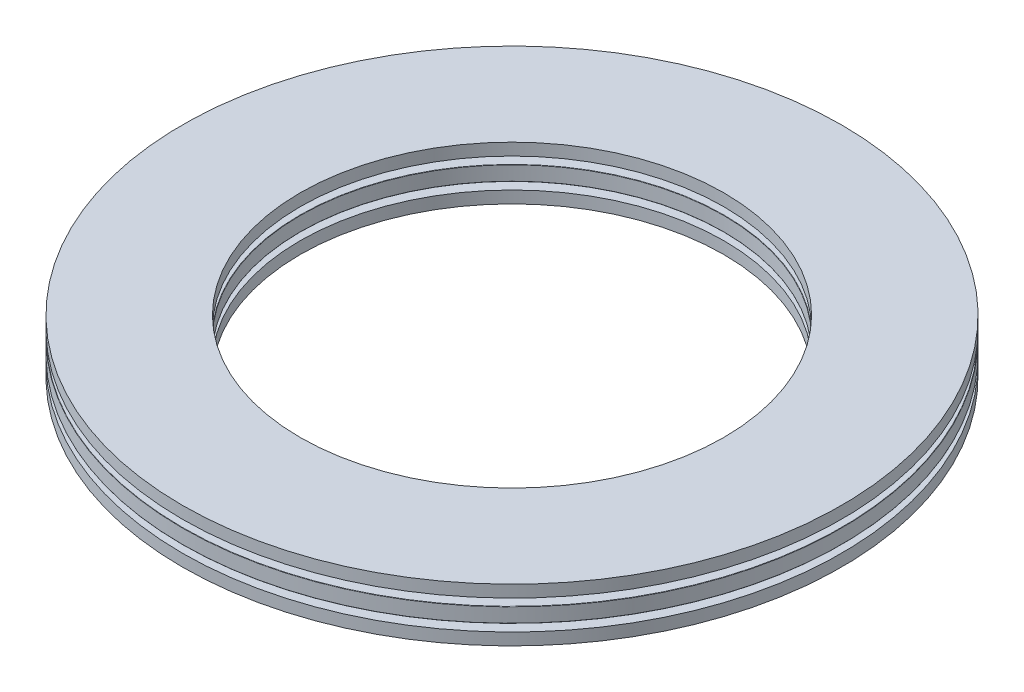
from build123d import *

# Parameters (mm, degrees)
SKETCH1_W                = 7.9375
SKETCH1_H                = 0.9921875
SKETCH3_W                = 5.953125
SKETCH3_H                = 0.9921875
SKETCH2_W                = 5.953125
SKETCH2_H                = 0.9921875
CIRPATTERN1_START        = -21.2328125
CIRPATTERN1_OUTLINE_R    = 0.9921875
CIRPATTERN1_DEPTH        = 5.953125
CIRPATTERN1_2_OUTLINE_R  = 0.9921875
CIRPATTERN1_2_DEPTH      = 5.953125
CIRPATTERN1_3_OUTLINE_R  = 0.9921875
CIRPATTERN1_3_DEPTH      = 5.953125
CIRPATTERN1_4_OUTLINE_R  = 0.9921875
CIRPATTERN1_4_DEPTH      = 5.953125
CIRPATTERN1_5_OUTLINE_R  = 0.9921875
CIRPATTERN1_5_DEPTH      = 5.953125
CIRPATTERN1_6_OUTLINE_R  = 0.9921875
CIRPATTERN1_6_DEPTH      = 5.953125
CIRPATTERN1_7_OUTLINE_R  = 0.9921875
CIRPATTERN1_7_DEPTH      = 5.953125
CIRPATTERN1_8_OUTLINE_R  = 0.9921875
CIRPATTERN1_8_DEPTH      = 5.953125
CIRPATTERN1_9_OUTLINE_R  = 0.9921875
CIRPATTERN1_9_DEPTH      = 5.953125
CIRPATTERN1_10_OUTLINE_R = 0.9921875
CIRPATTERN1_10_DEPTH     = 5.953125
CIRPATTERN1_11_OUTLINE_R = 0.9921875
CIRPATTERN1_11_DEPTH     = 5.953125
CIRPATTERN1_12_OUTLINE_R = 0.9921875
CIRPATTERN1_12_DEPTH     = 5.953125
CIRPATTERN1_13_OUTLINE_R = 0.9921875
CIRPATTERN1_13_DEPTH     = 5.953125
CIRPATTERN1_14_OUTLINE_R = 0.9921875
CIRPATTERN1_14_DEPTH     = 5.953125
CIRPATTERN1_15_OUTLINE_R = 0.9921875
CIRPATTERN1_15_DEPTH     = 5.953125
CIRPATTERN1_16_OUTLINE_R = 0.9921875
CIRPATTERN1_16_DEPTH     = 5.953125
CIRPATTERN1_17_OUTLINE_R = 0.9921875
CIRPATTERN1_17_DEPTH     = 5.953125
CIRPATTERN1_START_2      = 15.2796875
CIRPATTERN1_18_OUTLINE_R = 0.9921875
CIRPATTERN1_18_DEPTH     = 5.953125
CIRPATTERN1_19_OUTLINE_R = 0.9921875
CIRPATTERN1_19_DEPTH     = 5.953125
CIRPATTERN1_20_OUTLINE_R = 0.9921875
CIRPATTERN1_20_DEPTH     = 5.953125
CIRPATTERN1_21_OUTLINE_R = 0.9921875
CIRPATTERN1_21_DEPTH     = 5.953125
CIRPATTERN1_22_OUTLINE_R = 0.9921875
CIRPATTERN1_22_DEPTH     = 5.953125
CIRPATTERN1_23_OUTLINE_R = 0.9921875
CIRPATTERN1_23_DEPTH     = 5.953125
CIRPATTERN1_24_OUTLINE_R = 0.9921875
CIRPATTERN1_24_DEPTH     = 5.953125
CIRPATTERN1_25_OUTLINE_R = 0.9921875
CIRPATTERN1_25_DEPTH     = 5.953125
CIRPATTERN1_26_OUTLINE_R = 0.9921875
CIRPATTERN1_26_DEPTH     = 5.953125
CIRPATTERN1_27_OUTLINE_R = 0.9921875
CIRPATTERN1_27_DEPTH     = 5.953125
CIRPATTERN1_28_OUTLINE_R = 0.9921875
CIRPATTERN1_28_DEPTH     = 5.953125
CIRPATTERN1_29_OUTLINE_R = 0.9921875
CIRPATTERN1_29_DEPTH     = 5.953125
CIRPATTERN1_30_OUTLINE_R = 0.9921875
CIRPATTERN1_30_DEPTH     = 5.953125
CIRPATTERN1_31_OUTLINE_R = 0.9921875
CIRPATTERN1_31_DEPTH     = 5.953125
CIRPATTERN1_32_OUTLINE_R = 0.9921875
CIRPATTERN1_32_DEPTH     = 5.953125
CIRPATTERN1_33_OUTLINE_R = 0.9921875
CIRPATTERN1_33_DEPTH     = 5.953125
CIRPATTERN1_34_OUTLINE_R = 0.9921875
CIRPATTERN1_34_DEPTH     = 5.953125
CIRPATTERN2_COUNT        = 35
SKETCH4_W                = 7.9375
SKETCH4_H                = 0.8128
FILLET2_R                = 0.01984375


# Read off the part's stored shape, not the designer's step: CirPattern1
with BuildPart() as part:
    # Sketch1 → Revolve1 (revolve)
    with BuildSketch(Plane(origin=(0, 0, 0), x_dir=(0, 0, -1), z_dir=(1, 0, 0)), mode=Mode.PRIVATE) as revolve1_sk:
        with Locations((-18.25625, 0)):
            Rectangle(SKETCH1_W, SKETCH1_H)
    revolve(revolve1_sk.sketch.rotate(Axis((0, -0.9921875, 0), (0, 1, 0)), 180), axis=Axis((0, -0.9921875, 0), (0, 1, 0)))

    # Sketch3 → Cut-Revolve1 (revolve, cut)
    with BuildSketch(Plane(origin=(0, 0, 0), x_dir=(0, 0, -1), z_dir=(1, 0, 0))):
        with Locations((-18.25625, 0.49609375)):
            Rectangle(SKETCH3_W, SKETCH3_H)
    cut_revolve1 = revolve(axis=Axis((0, 0, 21.2328125), (0, 0, -1)), mode=Mode.SUBTRACT)

    # CirPattern2: Cut-Revolve1 ×35 about axis
    cirpattern2_axis = Axis((0, 0, 0), (0, 1, 0))
    for i in range(1, CIRPATTERN2_COUNT):
        add(cut_revolve1.rotate(cirpattern2_axis, i * 360 / CIRPATTERN2_COUNT), mode=Mode.SUBTRACT)

    # Fillet2
    fillet2_edges = [part.edges().sort_by_distance(p)[0] for p in [
        (0, 0.49609375, 22.225),
        (0, 0.49609375, 14.2875),
        (0, -0.49609375, 14.2875),
        (0, -0.49609375, 22.225),
    ]]
    fillet(fillet2_edges, radius=FILLET2_R)


with BuildPart() as body_2:
    # Sketch2 → Revolve2 (revolve)
    with BuildSketch(Plane(origin=(0, 0, 0), x_dir=(0, 0, -1), z_dir=(1, 0, 0)), mode=Mode.PRIVATE) as revolve2_sk:
        with Locations((-18.25625, 0.49609375)):
            Rectangle(SKETCH2_W, SKETCH2_H)
    revolve(revolve2_sk.sketch.rotate(Axis((0, 0, 21.2328125), (0, 0, -1)), 90), axis=Axis((0, 0, 21.2328125), (0, 0, -1)))


with BuildPart() as body_3:
    # CirPattern1 outline → CirPattern1 (new body)
    with BuildSketch(Plane(origin=(0, 0, 0), x_dir=(0.9839295885986321, 0, 0.17855689479862302), z_dir=(0.17855689479862302, 0, -0.9839295885986321)).offset(CIRPATTERN1_START)):
        Circle(CIRPATTERN1_OUTLINE_R)
    extrude(amount=CIRPATTERN1_DEPTH)


with BuildPart() as body_4:
    # CirPattern1 2 outline → CirPattern1 2 (new body)
    with BuildSketch(Plane(origin=(0, 0, 0), x_dir=(0.9362348706397416, 0, 0.351374824081331), z_dir=(0.35137482408133097, 0, -0.9362348706397418)).offset(CIRPATTERN1_START)):
        Circle(CIRPATTERN1_2_OUTLINE_R)
    extrude(amount=CIRPATTERN1_2_DEPTH)


with BuildPart() as body_5:
    # CirPattern1 3 outline → CirPattern1 3 (new body)
    with BuildSketch(Plane(origin=(0, 0, 0), x_dir=(0.8584487936018727, 0, 0.512899277405895), z_dir=(0.512899277405895, 0, -0.8584487936018729)).offset(CIRPATTERN1_START)):
        Circle(CIRPATTERN1_3_OUTLINE_R)
    extrude(amount=CIRPATTERN1_3_DEPTH)


with BuildPart() as body_6:
    # CirPattern1 4 outline → CirPattern1 4 (new body)
    with BuildSketch(Plane(origin=(0, 0, 0), x_dir=(0.7530714660036196, 0, 0.6579387259397027), z_dir=(0.6579387259397027, 0, -0.7530714660036196)).offset(CIRPATTERN1_START)):
        Circle(CIRPATTERN1_4_OUTLINE_R)
    extrude(amount=CIRPATTERN1_4_DEPTH)


with BuildPart() as body_7:
    # CirPattern1 5 outline → CirPattern1 5 (new body)
    with BuildSketch(Plane(origin=(0, 0, 0), x_dir=(0.6234898018587433, 0, 0.7818314824680221), z_dir=(0.7818314824680221, 0, -0.6234898018587431)).offset(CIRPATTERN1_START)):
        Circle(CIRPATTERN1_5_OUTLINE_R)
    extrude(amount=CIRPATTERN1_5_DEPTH)


with BuildPart() as body_8:
    # CirPattern1 6 outline → CirPattern1 6 (new body)
    with BuildSketch(Plane(origin=(0, 0, 0), x_dir=(0.47386866247300885, 0, 0.8805955318567326), z_dir=(0.8805955318567324, 0, -0.47386866247300924)).offset(CIRPATTERN1_START)):
        Circle(CIRPATTERN1_6_OUTLINE_R)
    extrude(amount=CIRPATTERN1_6_DEPTH)


with BuildPart() as body_9:
    # CirPattern1 7 outline → CirPattern1 7 (new body)
    with BuildSketch(Plane(origin=(0, 0, 0), x_dir=(0, 1, 0), z_dir=(0.9510565162951502, 0, -0.30901699437495805)).offset(CIRPATTERN1_START)):
        Circle(CIRPATTERN1_7_OUTLINE_R)
    extrude(amount=CIRPATTERN1_7_DEPTH)


with BuildPart() as body_10:
    # CirPattern1 8 outline → CirPattern1 8 (new body)
    with BuildSketch(Plane(origin=(0, 0, 0), x_dir=(0, 1, 0), z_dir=(0.9909497617679331, 0, -0.13423326581766704)).offset(CIRPATTERN1_START)):
        Circle(CIRPATTERN1_8_OUTLINE_R)
    extrude(amount=CIRPATTERN1_8_DEPTH)


with BuildPart() as body_11:
    # CirPattern1 9 outline → CirPattern1 9 (new body)
    with BuildSketch(Plane(origin=(0, 0, 0), x_dir=(0, 1, 0), z_dir=(0.9989930665413151, 0, 0.04486483035050451)).offset(CIRPATTERN1_START)):
        Circle(CIRPATTERN1_9_OUTLINE_R)
    extrude(amount=CIRPATTERN1_9_DEPTH)


with BuildPart() as body_12:
    # CirPattern1 10 outline → CirPattern1 10 (new body)
    with BuildSketch(Plane(origin=(0, 0, 0), x_dir=(0, 1, 0), z_dir=(0.974927912181826, 0, 0.222520933956304)).offset(CIRPATTERN1_START)):
        Circle(CIRPATTERN1_10_OUTLINE_R)
    extrude(amount=CIRPATTERN1_10_DEPTH)


with BuildPart() as body_13:
    # CirPattern1 11 outline → CirPattern1 11 (new body)
    with BuildSketch(Plane(origin=(0, 0, 0), x_dir=(0, 1, 0), z_dir=(0.9195277725514543, 0, 0.3930250316539151)).offset(CIRPATTERN1_START)):
        Circle(CIRPATTERN1_11_OUTLINE_R)
    extrude(amount=CIRPATTERN1_11_DEPTH)


with BuildPart() as body_14:
    # CirPattern1 12 outline → CirPattern1 12 (new body)
    with BuildSketch(Plane(origin=(0, 0, 0), x_dir=(0.5508969814520949, 0, -0.8345732537213078), z_dir=(0.8345732537213078, 0, 0.5508969814520949)).offset(CIRPATTERN1_START)):
        Circle(CIRPATTERN1_12_OUTLINE_R)
    extrude(amount=CIRPATTERN1_12_DEPTH)


with BuildPart() as body_15:
    # CirPattern1 13 outline → CirPattern1 13 (new body)
    with BuildSketch(Plane(origin=(0, 0, 0), x_dir=(0.6910626489868578, 0, -0.722794863827398), z_dir=(0.722794863827398, 0, 0.691062648986858)).offset(CIRPATTERN1_START)):
        Circle(CIRPATTERN1_13_OUTLINE_R)
    extrude(amount=CIRPATTERN1_13_DEPTH)


with BuildPart() as body_16:
    # CirPattern1 14 outline → CirPattern1 14 (new body)
    with BuildSketch(Plane(origin=(0, 0, 0), x_dir=(0.8090169943749422, 0, -0.5877852522924802), z_dir=(0.5877852522924802, 0, 0.8090169943749422)).offset(CIRPATTERN1_START)):
        Circle(CIRPATTERN1_14_OUTLINE_R)
    extrude(amount=CIRPATTERN1_14_DEPTH)


with BuildPart() as body_17:
    # CirPattern1 15 outline → CirPattern1 15 (new body)
    with BuildSketch(Plane(origin=(0, 0, 0), x_dir=(0.9009688679024151, 0, -0.43388373911756617), z_dir=(0.43388373911756617, 0, 0.9009688679024154)).offset(CIRPATTERN1_START)):
        Circle(CIRPATTERN1_15_OUTLINE_R)
    extrude(amount=CIRPATTERN1_15_DEPTH)


with BuildPart() as body_18:
    # CirPattern1 16 outline → CirPattern1 16 (new body)
    with BuildSketch(Plane(origin=(0, 0, 0), x_dir=(0.963962860695851, 0, -0.26603684556668306), z_dir=(0.26603684556668306, 0, 0.9639628606958511)).offset(CIRPATTERN1_START)):
        Circle(CIRPATTERN1_16_OUTLINE_R)
    extrude(amount=CIRPATTERN1_16_DEPTH)


with BuildPart() as body_19:
    # CirPattern1 17 outline → CirPattern1 17 (new body)
    with BuildSketch(Plane(origin=(0, 0, 0), x_dir=(0.9959742939952383, 0, -0.08963930890344095), z_dir=(0.08963930890344095, 0, 0.9959742939952384)).offset(CIRPATTERN1_START)):
        Circle(CIRPATTERN1_17_OUTLINE_R)
    extrude(amount=CIRPATTERN1_17_DEPTH)


with BuildPart() as body_20:
    # CirPattern1 18 outline → CirPattern1 18 (new body)
    with BuildSketch(Plane(origin=(0, 0, 0), x_dir=(0.9959742939952396, 0, 0.0896393089034265), z_dir=(0.08963930890342649, 0, -0.9959742939952397)).offset(CIRPATTERN1_START_2)):
        Circle(CIRPATTERN1_18_OUTLINE_R)
    extrude(amount=CIRPATTERN1_18_DEPTH)


with BuildPart() as body_21:
    # CirPattern1 19 outline → CirPattern1 19 (new body)
    with BuildSketch(Plane(origin=(0, 0, 0), x_dir=(0.963962860695855, 0, 0.26603684556666907), z_dir=(0.266036845566669, 0, -0.963962860695855)).offset(CIRPATTERN1_START_2)):
        Circle(CIRPATTERN1_19_OUTLINE_R)
    extrude(amount=CIRPATTERN1_19_DEPTH)


with BuildPart() as body_22:
    # CirPattern1 20 outline → CirPattern1 20 (new body)
    with BuildSketch(Plane(origin=(0, 0, 0), x_dir=(0.9009688679024216, 0, 0.43388373911755285), z_dir=(0.4338837391175529, 0, -0.9009688679024217)).offset(CIRPATTERN1_START_2)):
        Circle(CIRPATTERN1_20_OUTLINE_R)
    extrude(amount=CIRPATTERN1_20_DEPTH)


with BuildPart() as body_23:
    # CirPattern1 21 outline → CirPattern1 21 (new body)
    with BuildSketch(Plane(origin=(0, 0, 0), x_dir=(0.8090169943749506, 0, 0.5877852522924688), z_dir=(0.5877852522924688, 0, -0.8090169943749507)).offset(CIRPATTERN1_START_2)):
        Circle(CIRPATTERN1_21_OUTLINE_R)
    extrude(amount=CIRPATTERN1_21_DEPTH)


with BuildPart() as body_24:
    # CirPattern1 22 outline → CirPattern1 22 (new body)
    with BuildSketch(Plane(origin=(0, 0, 0), x_dir=(0.6910626489868685, 0, 0.7227948638273879), z_dir=(0.7227948638273878, 0, -0.6910626489868688)).offset(CIRPATTERN1_START_2)):
        Circle(CIRPATTERN1_22_OUTLINE_R)
    extrude(amount=CIRPATTERN1_22_DEPTH)


with BuildPart() as body_25:
    # CirPattern1 23 outline → CirPattern1 23 (new body)
    with BuildSketch(Plane(origin=(0, 0, 0), x_dir=(0.5508969814521066, 0, 0.8345732537213001), z_dir=(0.8345732537212999, 0, -0.550896981452107)).offset(CIRPATTERN1_START_2)):
        Circle(CIRPATTERN1_23_OUTLINE_R)
    extrude(amount=CIRPATTERN1_23_DEPTH)


with BuildPart() as body_26:
    # CirPattern1 24 outline → CirPattern1 24 (new body)
    with BuildSketch(Plane(origin=(0, 0, 0), x_dir=(0, 1, 0), z_dir=(0.9195277725514488, 0, -0.3930250316539279)).offset(CIRPATTERN1_START_2)):
        Circle(CIRPATTERN1_24_OUTLINE_R)
    extrude(amount=CIRPATTERN1_24_DEPTH)


with BuildPart() as body_27:
    # CirPattern1 25 outline → CirPattern1 25 (new body)
    with BuildSketch(Plane(origin=(0, 0, 0), x_dir=(0, 1, 0), z_dir=(0.9749279121818228, 0, -0.22252093395631797)).offset(CIRPATTERN1_START_2)):
        Circle(CIRPATTERN1_25_OUTLINE_R)
    extrude(amount=CIRPATTERN1_25_DEPTH)


with BuildPart() as body_28:
    # CirPattern1 26 outline → CirPattern1 26 (new body)
    with BuildSketch(Plane(origin=(0, 0, 0), x_dir=(0, 1, 0), z_dir=(0.9989930665413145, 0, -0.04486483035051862)).offset(CIRPATTERN1_START_2)):
        Circle(CIRPATTERN1_26_OUTLINE_R)
    extrude(amount=CIRPATTERN1_26_DEPTH)


with BuildPart() as body_29:
    # CirPattern1 27 outline → CirPattern1 27 (new body)
    with BuildSketch(Plane(origin=(0, 0, 0), x_dir=(0, 1, 0), z_dir=(0.9909497617679353, 0, 0.13423326581765202)).offset(CIRPATTERN1_START_2)):
        Circle(CIRPATTERN1_27_OUTLINE_R)
    extrude(amount=CIRPATTERN1_27_DEPTH)


with BuildPart() as body_30:
    # CirPattern1 28 outline → CirPattern1 28 (new body)
    with BuildSketch(Plane(origin=(0, 0, 0), x_dir=(0, 1, 0), z_dir=(0.9510565162951545, 0, 0.3090169943749449)).offset(CIRPATTERN1_START_2)):
        Circle(CIRPATTERN1_28_OUTLINE_R)
    extrude(amount=CIRPATTERN1_28_DEPTH)


with BuildPart() as body_31:
    # CirPattern1 29 outline → CirPattern1 29 (new body)
    with BuildSketch(Plane(origin=(0, 0, 0), x_dir=(0.47386866247299664, 0, -0.8805955318567391), z_dir=(0.880595531856739, 0, 0.473868662472997)).offset(CIRPATTERN1_START_2)):
        Circle(CIRPATTERN1_29_OUTLINE_R)
    extrude(amount=CIRPATTERN1_29_DEPTH)


with BuildPart() as body_32:
    # CirPattern1 30 outline → CirPattern1 30 (new body)
    with BuildSketch(Plane(origin=(0, 0, 0), x_dir=(0.623489801858732, 0, -0.781831482468031), z_dir=(0.781831482468031, 0, 0.623489801858732)).offset(CIRPATTERN1_START_2)):
        Circle(CIRPATTERN1_30_OUTLINE_R)
    extrude(amount=CIRPATTERN1_30_DEPTH)


with BuildPart() as body_33:
    # CirPattern1 31 outline → CirPattern1 31 (new body)
    with BuildSketch(Plane(origin=(0, 0, 0), x_dir=(0.7530714660036096, 0, -0.6579387259397141), z_dir=(0.657938725939714, 0, 0.7530714660036099)).offset(CIRPATTERN1_START_2)):
        Circle(CIRPATTERN1_31_OUTLINE_R)
    extrude(amount=CIRPATTERN1_31_DEPTH)


with BuildPart() as body_34:
    # CirPattern1 32 outline → CirPattern1 32 (new body)
    with BuildSketch(Plane(origin=(0, 0, 0), x_dir=(0.8584487936018655, 0, -0.5128992774059069), z_dir=(0.5128992774059069, 0, 0.8584487936018658)).offset(CIRPATTERN1_START_2)):
        Circle(CIRPATTERN1_32_OUTLINE_R)
    extrude(amount=CIRPATTERN1_32_DEPTH)


with BuildPart() as body_35:
    # CirPattern1 33 outline → CirPattern1 33 (new body)
    with BuildSketch(Plane(origin=(0, 0, 0), x_dir=(0.9362348706397371, 0, -0.3513748240813431), z_dir=(0.3513748240813431, 0, 0.9362348706397371)).offset(CIRPATTERN1_START_2)):
        Circle(CIRPATTERN1_33_OUTLINE_R)
    extrude(amount=CIRPATTERN1_33_DEPTH)


with BuildPart() as body_36:
    # CirPattern1 34 outline → CirPattern1 34 (new body)
    with BuildSketch(Plane(origin=(0, 0, 0), x_dir=(0.9839295885986297, 0, -0.17855689479863696), z_dir=(0.17855689479863696, 0, 0.9839295885986297)).offset(CIRPATTERN1_START_2)):
        Circle(CIRPATTERN1_34_OUTLINE_R)
    extrude(amount=CIRPATTERN1_34_DEPTH)


with BuildPart() as body_37:
    # Sketch4 → Revolve3 (revolve)
    with BuildSketch(Plane(origin=(0, 0, 0), x_dir=(0, 0, -1), z_dir=(1, 0, 0)), mode=Mode.PRIVATE) as revolve3_sk:
        with Locations((-18.25625, 1.3973175)):
            Rectangle(SKETCH4_W, SKETCH4_H)
        with Locations((-18.25625, -1.3973175)):
            Rectangle(SKETCH4_W, SKETCH4_H)
    revolve(revolve3_sk.sketch.rotate(Axis((0, -0.9921875, 0), (0, 1, 0)), 180), axis=Axis((0, -0.9921875, 0), (0, 1, 0)))


solid = Compound([part.part, body_2.part, body_3.part, body_4.part, body_5.part, body_6.part, body_7.part, body_8.part, body_9.part, body_10.part, body_11.part, body_12.part, body_13.part, body_14.part, body_15.part, body_16.part, body_17.part, body_18.part, body_19.part, body_20.part, body_21.part, body_22.part, body_23.part, body_24.part, body_25.part, body_26.part, body_27.part, body_28.part, body_29.part, body_30.part, body_31.part, body_32.part, body_33.part, body_34.part, body_35.part, body_36.part, body_37.part])
